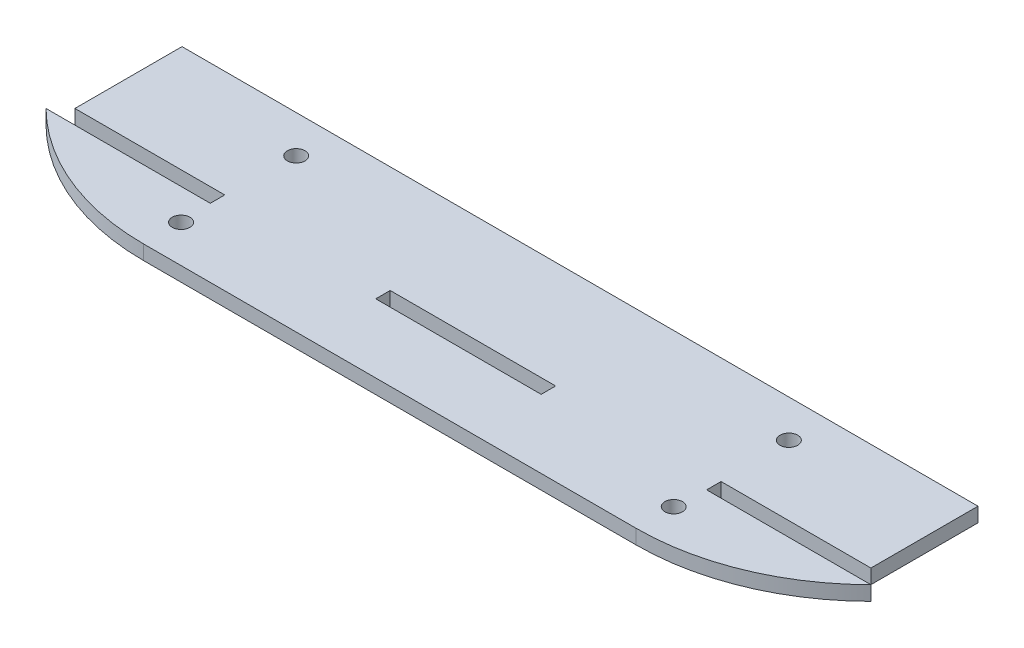
from build123d import *

# Parameters (mm, degrees)
SKETCH1_R           = 1.65
SKETCH1_W           = 30.896767392
SKETCH1_H           = 2.7
BOSS_EXTRUDE1_DEPTH = 2.7


with BuildPart() as part:
    # Sketch1 → Boss-Extrude1 (new body)
    with BuildSketch(Plane(origin=(0, 0, 0), x_dir=(1, 0, 0), z_dir=(0, 1, 0))):
        with BuildLine():
            Line((46.345151087, 15.5), (74.325151093, 15.5))
            Line((74.325151093, 15.5), (74.325151093, 35.5))
            Line((74.325151093, 35.5), (-74.325151087, 35.5))
            Line((-74.325151087, 35.5), (-74.325151087, 15.5))
            Line((-74.325151087, 15.5), (-46.345151087, 15.5))
            Line((-46.345151087, 15.5), (-46.345151087, 12.8))
            Line((-46.345151087, 12.8), (-77.025151087, 12.8))
            ThreePointArc((-77.025151087, 12.8), (-62.780941571, 3.32568378), (-46, 0))
            Line((-46, 0), (46, 0))
            ThreePointArc((46, 0), (62.780941571, 3.32568378), (77.025151087, 12.8))
            Line((77.025151087, 12.8), (46.345151087, 12.8))
            Line((46.345151087, 12.8), (46.345151087, 15.5))
        make_face()
        with Locations((46, 28.5)):
            Circle(SKETCH1_R, mode=Mode.SUBTRACT)
        with Locations((46, 7)):
            Circle(SKETCH1_R, mode=Mode.SUBTRACT)
        with Locations((-46, 7)):
            Circle(SKETCH1_R, mode=Mode.SUBTRACT)
        with Locations((-46, 28.5)):
            Circle(SKETCH1_R, mode=Mode.SUBTRACT)
        with Locations((0, 14.15)):
            Rectangle(SKETCH1_W, SKETCH1_H, mode=Mode.SUBTRACT)
    extrude(amount=BOSS_EXTRUDE1_DEPTH)


solid = part.part
